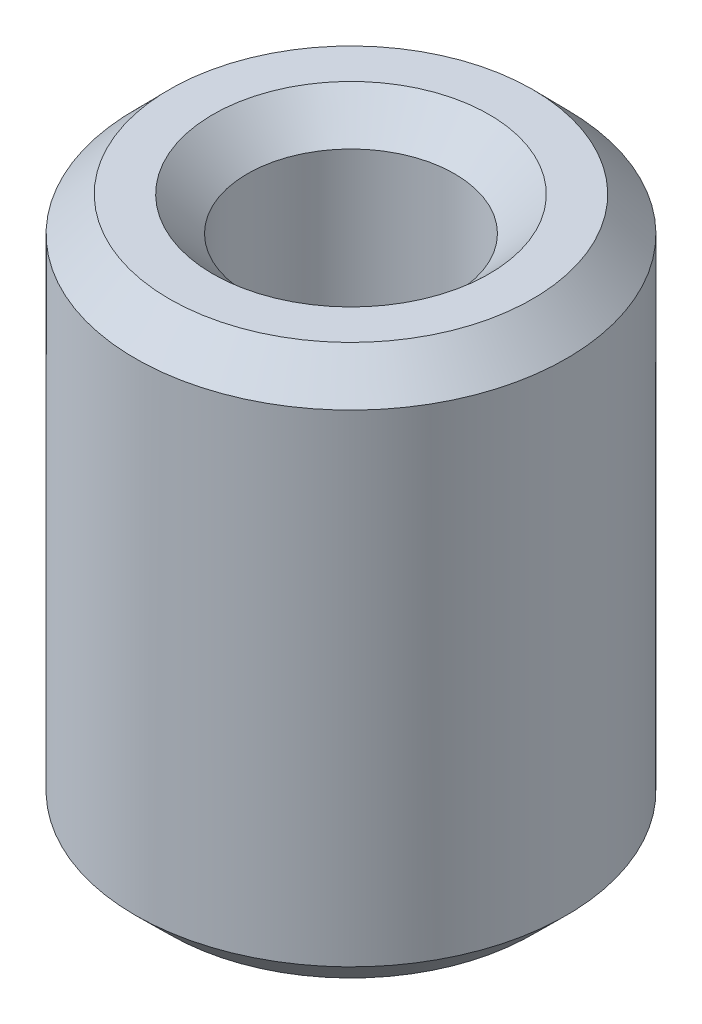
from build123d import *
from OCP.BRepFilletAPI import BRepFilletAPI_MakeChamfer

# Parameters (mm, degrees)
SKETCH1_R           = 7.5
BOSS_EXTRUDE1_DEPTH = 19.157499299
SKETCH2_R           = 3.603717049
CUT_EXTRUDE1_DEPTH  = 22.897711739
CHAMFER1_SIZE       = 1.201096207
CHAMFER1_SIZE2      = 1.184737374


with BuildPart() as part:
    # Sketch1 → Boss-Extrude1 (new body)
    with BuildSketch(Plane(origin=(0, 0, 0), x_dir=(1, 0, 0), z_dir=(0, 1, 0))):
        Circle(SKETCH1_R)
    extrude(amount=BOSS_EXTRUDE1_DEPTH)

    # Sketch2 → Cut-Extrude1 (cut, through all)
    with BuildSketch(Plane(origin=(0, 0, 0), x_dir=(1, 0, 0), z_dir=(0, 1, 0))):
        Circle(SKETCH2_R)
    extrude(amount=CUT_EXTRUDE1_DEPTH, mode=Mode.SUBTRACT)

    # Chamfer1: one chamfer whose edges measure the first distance from different faces: ONE call of the kernel's chamfer builder (chamfer() names one face for all edges)
    chamfer1_edges_1 = [part.edges().sort_by_distance(p)[0] for p in [
        (-3.603717049, 19.157499299, 0),
    ]]
    chamfer1_side_1 = [part.faces().sort_by_distance(p)[0] for p in [
        (-7.287867966, 19.157499299, 0),
    ]]
    chamfer1_edges_2 = [part.edges().sort_by_distance(p)[0] for p in [
        (-3.603717049, 0, 0),
    ]]
    chamfer1_side_2 = [part.faces().sort_by_distance(p)[0] for p in [
        (-3.603717049, 9.57874965, 0),
    ]]
    chamfer1_edges_3 = [part.edges().sort_by_distance(p)[0] for p in [
        (-7.5, 0, 0),
    ]]
    chamfer1_side_3 = [part.faces().sort_by_distance(p)[0] for p in [
        (-7.287867966, 0, 0),
    ]]
    chamfer1_edges_4 = [part.edges().sort_by_distance(p)[0] for p in [
        (-7.5, 19.157499299, 0),
    ]]
    chamfer1_side_4 = [part.faces().sort_by_distance(p)[0] for p in [
        (-7.5, 9.57874965, 0),
    ]]
    chamfer1 = BRepFilletAPI_MakeChamfer(part.part.solid().wrapped)
    for e in chamfer1_edges_1:
        chamfer1.Add(CHAMFER1_SIZE, CHAMFER1_SIZE2, e.wrapped, chamfer1_side_1[0].wrapped)  # the first distance lies on this face
    for e in chamfer1_edges_2:
        chamfer1.Add(CHAMFER1_SIZE, CHAMFER1_SIZE2, e.wrapped, chamfer1_side_2[0].wrapped)  # the first distance lies on this face
    for e in chamfer1_edges_3:
        chamfer1.Add(CHAMFER1_SIZE, CHAMFER1_SIZE2, e.wrapped, chamfer1_side_3[0].wrapped)  # the first distance lies on this face
    for e in chamfer1_edges_4:
        chamfer1.Add(CHAMFER1_SIZE, CHAMFER1_SIZE2, e.wrapped, chamfer1_side_4[0].wrapped)  # the first distance lies on this face
    add(Compound.cast(chamfer1.Shape()), mode=Mode.REPLACE)


solid = part.part
